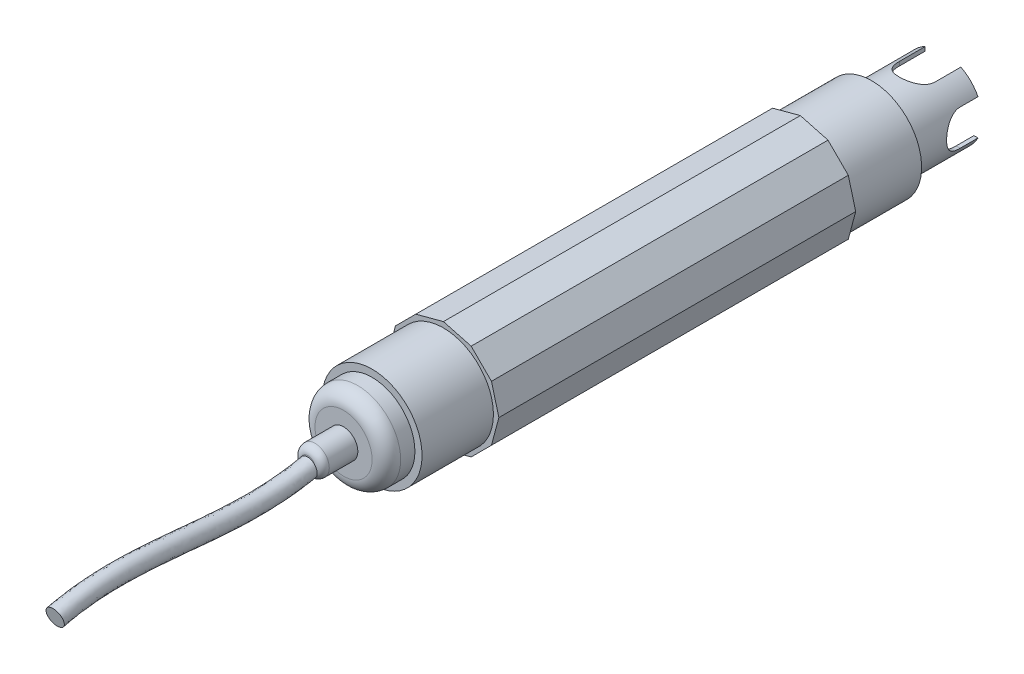
from build123d import *

# Parameters (mm, degrees)
BOSS_EXTRUDE1_DEPTH            = 100
SKETCH2_R                      = 14
BOSS_EXTRUDE2_DEPTH            = 20
SKETCH3_R                      = 12
BOSS_EXTRUDE3_DEPTH            = 8
FILLET1_R                      = 4
SKETCH4_R                      = 4
BOSS_EXTRUDE4_DEPTH            = 10
FILLET2_R                      = 2
BOSS_EXTRUDE6_START            = 20
SKETCH6_R                      = 14
BOSS_EXTRUDE6_DEPTH            = 20
SKETCH7_R                      = 11
SKETCH7_R_2                    = 10
BOSS_EXTRUDE7_DEPTH            = 20
CUT_EXTRUDE1_REACH             = 143.712
CUT_EXTRUDE1_DIRECTION_2_REACH = 143.712
CUT_EXTRUDE2_REACH             = 143.712
CUT_EXTRUDE2_DIRECTION_2_REACH = 143.712
SKETCH10_R                     = 10
BOSS_EXTRUDE8_DEPTH            = 8
SKETCH11_R                     = 3
BOSS_EXTRUDE9_DEPTH            = 6
FILLET3_R                      = 3
SWEEP1_PROFILE_R               = 2.5


with BuildPart() as part:
    # Sketch1 → Boss-Extrude1 (new body)
    with BuildSketch(Plane.XY):
        Polygon((-15.529142706, 0), (-13.448632083, -7.764571353), (-7.764571353, -13.448632083), (0, -15.529142706), (7.764571353, -13.448632083), (13.448632083, -7.764571353), (15.529142706, 0), (13.448632083, 7.764571353), (7.764571353, 13.448632083), (0, 15.529142706), (-7.764571353, 13.448632083), (-13.448632083, 7.764571353), align=None)
    extrude(amount=-BOSS_EXTRUDE1_DEPTH)

    # Sketch2 → Boss-Extrude2 (add)
    with BuildSketch(Plane.XY):
        Circle(SKETCH2_R)
    extrude(amount=BOSS_EXTRUDE2_DEPTH)

    # Sketch3 → Boss-Extrude3 (add)
    with BuildSketch(Plane.XY.offset(20)):
        Circle(SKETCH3_R)
    extrude(amount=BOSS_EXTRUDE3_DEPTH)

    # Fillet1
    fillet1_edges = [part.edges().sort_by_distance(p)[0] for p in [
        (-12, 0, 28),
    ]]
    fillet(fillet1_edges, radius=FILLET1_R)

    # Sketch4 → Boss-Extrude4 (add)
    with BuildSketch(Plane.XY.offset(28)):
        Circle(SKETCH4_R)
    extrude(amount=BOSS_EXTRUDE4_DEPTH)

    # Fillet2
    fillet2_edges = [part.edges().sort_by_distance(p)[0] for p in [
        (-4, 0, 38),
    ]]
    fillet(fillet2_edges, radius=FILLET2_R)

    # Sketch6 → Boss-Extrude6 (add)
    with BuildSketch(Plane(origin=(0, 0, -100), x_dir=(-1, 0, 0), z_dir=(0, 0, -1)).offset(BOSS_EXTRUDE6_START)):
        Circle(SKETCH6_R)
    extrude(amount=-BOSS_EXTRUDE6_DEPTH)

    # Sketch7 → Boss-Extrude7 (add)
    with BuildSketch(Plane(origin=(0, 0, -120), x_dir=(-1, 0, 0), z_dir=(0, 0, -1))):
        Circle(SKETCH7_R)
        Circle(SKETCH7_R_2, mode=Mode.SUBTRACT)
    extrude(amount=BOSS_EXTRUDE7_DEPTH)

    # Sketch8 → Cut-Extrude1 (cut, up to next)
    with BuildSketch(Plane(origin=(0, 0, 0), x_dir=(0, 0, -1), z_dir=(1, 0, 0)), mode=Mode.PRIVATE) as cut_extrude1_sk1:
        with BuildLine():
            Line((145, -5), (135, -5))
            ThreePointArc((135, -5), (130, 0), (135, 5))
            Line((135, 5), (145, 5))
            Line((145, 5), (145, -5))
        make_face()
    cut_extrude1_tool1 = extrude(cut_extrude1_sk1.sketch, amount=-CUT_EXTRUDE1_REACH, mode=Mode.PRIVATE) & part.part
    add(cut_extrude1_tool1.solids().sort_by_distance((0, 0, -137.991792))[0], mode=Mode.SUBTRACT)

    # Sketch8 → Cut-Extrude1 direction 2 (cut, up to next)
    with BuildSketch(Plane(origin=(0, 0, 0), x_dir=(0, 0, -1), z_dir=(1, 0, 0)), mode=Mode.PRIVATE) as cut_extrude1_direction_2_sk1:
        with BuildLine():
            Line((145, -5), (135, -5))
            ThreePointArc((135, -5), (130, 0), (135, 5))
            Line((135, 5), (145, 5))
            Line((145, 5), (145, -5))
        make_face()
    cut_extrude1_direction_2_tool1 = extrude(cut_extrude1_direction_2_sk1.sketch, amount=CUT_EXTRUDE1_DIRECTION_2_REACH, mode=Mode.PRIVATE) & part.part
    add(cut_extrude1_direction_2_tool1.solids().sort_by_distance((0, 0, -137.991792))[0], mode=Mode.SUBTRACT)

    # Sketch9 → Cut-Extrude2 (cut, up to next)
    with BuildSketch(Plane(origin=(0, 0, 0), x_dir=(1, 0, 0), z_dir=(0, 1, 0)), mode=Mode.PRIVATE) as cut_extrude2_sk1:
        with BuildLine():
            Line((-5, 132.755823636), (-5, 147.244176364))
            Line((-5, 147.244176364), (5, 147.244176364))
            Line((5, 147.244176364), (5, 132.755823636))
            ThreePointArc((5, 132.755823636), (0, 127.755823636), (-5, 132.755823636))
        make_face()
    cut_extrude2_tool1 = extrude(cut_extrude2_sk1.sketch, amount=-CUT_EXTRUDE2_REACH, mode=Mode.PRIVATE) & part.part
    add(cut_extrude2_tool1.solids().sort_by_distance((0, 0, -138.00269))[0], mode=Mode.SUBTRACT)

    # Sketch9 → Cut-Extrude2 direction 2 (cut, up to next)
    with BuildSketch(Plane(origin=(0, 0, 0), x_dir=(1, 0, 0), z_dir=(0, 1, 0)), mode=Mode.PRIVATE) as cut_extrude2_direction_2_sk1:
        with BuildLine():
            Line((-5, 132.755823636), (-5, 147.244176364))
            Line((-5, 147.244176364), (5, 147.244176364))
            Line((5, 147.244176364), (5, 132.755823636))
            ThreePointArc((5, 132.755823636), (0, 127.755823636), (-5, 132.755823636))
        make_face()
    cut_extrude2_direction_2_tool1 = extrude(cut_extrude2_direction_2_sk1.sketch, amount=CUT_EXTRUDE2_DIRECTION_2_REACH, mode=Mode.PRIVATE) & part.part
    add(cut_extrude2_direction_2_tool1.solids().sort_by_distance((0, 0, -138.00269))[0], mode=Mode.SUBTRACT)

    # Sketch10 → Boss-Extrude8 (add)
    with BuildSketch(Plane(origin=(0, 0, -120), x_dir=(-1, 0, 0), z_dir=(0, 0, -1))):
        Circle(SKETCH10_R)
    extrude(amount=BOSS_EXTRUDE8_DEPTH)

    # Sketch11 → Boss-Extrude9 (add)
    with BuildSketch(Plane(origin=(0, 0, -128), x_dir=(-1, 0, 0), z_dir=(0, 0, -1))):
        Circle(SKETCH11_R)
    extrude(amount=BOSS_EXTRUDE9_DEPTH)

    # Fillet3
    fillet3_edges = [part.edges().sort_by_distance(p)[0] for p in [
        (3, 0, -134),
    ]]
    fillet(fillet3_edges, radius=FILLET3_R)

    # Sweep1: sweep along a path in Sketch23
    with BuildLine() as sweep1_path:  # in the path sketch's own coordinates; laid on its plane below (add() does not lay a ready-made edge on the line's plane)
        add(Edge.make_bspline(
            [(-34.218256452, 0), (-59.08096762, -6.905121768), (-83.985922069, 4.252508273), (-108.81618997, -1.844268726)],
            knots=[0, 0, 0, 0, 1, 1, 1, 1], degree=3))
    # Sweep1 profile (on start of the path) → Sweep1 (sweep)
    with BuildSketch(Plane(origin=(0, 0, 34.218256452), x_dir=(0, 0.9635297703105489, 0.267601161666576), z_dir=(0, -0.267601161666576, 0.9635297703105489))):
        Circle(SWEEP1_PROFILE_R)
    sweep(path=Plane(origin=(0, 0, 0), x_dir=(0, 0, -1), z_dir=(1, 0, 0)) * sweep1_path.line)


solid = part.part
